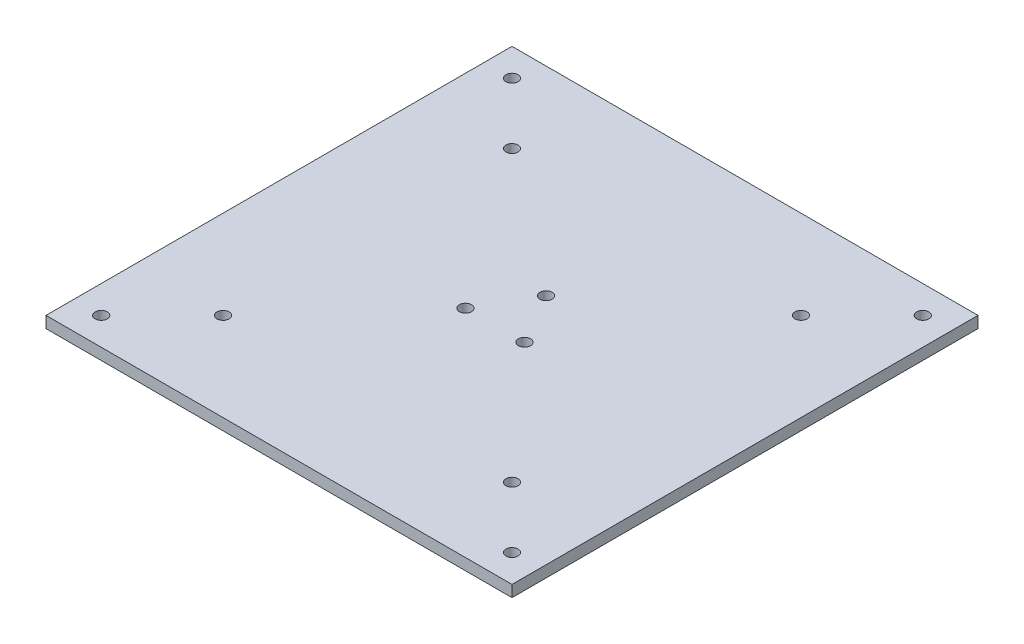
from build123d import *

# Parameters (mm, degrees)
SKETCH2_W           = 130
SKETCH2_H           = 130
BOSS_EXTRUDE1_DEPTH = 3.2
CUT_EXTRUDE1_REACH  = 93.98
SKETCH4_R           = 1.7
CUT_EXTRUDE2_REACH  = 93.98
SKETCH6_R           = 1.7
SKETCH7_R           = 4.25
BOSS_EXTRUDE3_DEPTH = 3.5
FILLET3_R           = 1.5
FILLET4_R           = 0.8
CUT_EXTRUDE3_REACH  = 94.168
SKETCH8_R           = 1.7


with BuildPart() as part:
    # Sketch2 → Boss-Extrude1 (new body)
    with BuildSketch(Plane(origin=(0, 0, 0), x_dir=(1, 0, 0), z_dir=(0, 1, 0))):
        Rectangle(SKETCH2_W, SKETCH2_H)
    extrude(amount=BOSS_EXTRUDE1_DEPTH)

    # Sketch4 → Cut-Extrude1 (cut, up to next)
    with BuildSketch(Plane(origin=(0, 3.2, 0), x_dir=(1, 0, 0), z_dir=(0, 1, 0)), mode=Mode.PRIVATE) as cut_extrude1_sk1:
        with Locations((-57.3, 57.3)):
            Circle(SKETCH4_R)
    cut_extrude1_tool1 = extrude(cut_extrude1_sk1.sketch, amount=-CUT_EXTRUDE1_REACH, mode=Mode.PRIVATE) & part.part
    # Sketch4 → Cut-Extrude1 (cut, up to next)
    with BuildSketch(Plane(origin=(0, 3.2, 0), x_dir=(1, 0, 0), z_dir=(0, 1, 0)), mode=Mode.PRIVATE) as cut_extrude1_sk2:
        with Locations((57.3, 57.3)):
            Circle(SKETCH4_R)
    cut_extrude1_tool2 = extrude(cut_extrude1_sk2.sketch, amount=-CUT_EXTRUDE1_REACH, mode=Mode.PRIVATE) & part.part
    # Sketch4 → Cut-Extrude1 (cut, up to next)
    with BuildSketch(Plane(origin=(0, 3.2, 0), x_dir=(1, 0, 0), z_dir=(0, 1, 0)), mode=Mode.PRIVATE) as cut_extrude1_sk3:
        with Locations((57.3, -57.3)):
            Circle(SKETCH4_R)
    cut_extrude1_tool3 = extrude(cut_extrude1_sk3.sketch, amount=-CUT_EXTRUDE1_REACH, mode=Mode.PRIVATE) & part.part
    # Sketch4 → Cut-Extrude1 (cut, up to next)
    with BuildSketch(Plane(origin=(0, 3.2, 0), x_dir=(1, 0, 0), z_dir=(0, 1, 0)), mode=Mode.PRIVATE) as cut_extrude1_sk4:
        with Locations((-57.3, -57.3)):
            Circle(SKETCH4_R)
    cut_extrude1_tool4 = extrude(cut_extrude1_sk4.sketch, amount=-CUT_EXTRUDE1_REACH, mode=Mode.PRIVATE) & part.part
    add(cut_extrude1_tool1.solids().sort_by_distance((-57.3, 3.2, -57.3))[0], mode=Mode.SUBTRACT)
    add(cut_extrude1_tool2.solids().sort_by_distance((57.3, 3.2, -57.3))[0], mode=Mode.SUBTRACT)
    add(cut_extrude1_tool3.solids().sort_by_distance((57.3, 3.2, 57.3))[0], mode=Mode.SUBTRACT)
    add(cut_extrude1_tool4.solids().sort_by_distance((-57.3, 3.2, 57.3))[0], mode=Mode.SUBTRACT)

    # Sketch6 → Cut-Extrude2 (cut, up to next)
    with BuildSketch(Plane(origin=(0, 3.2, 0), x_dir=(1, 0, 0), z_dir=(0, 1, 0)), mode=Mode.PRIVATE) as cut_extrude2_sk1:
        with Locations((-40.305086528, 40.305086528)):
            Circle(SKETCH6_R)
    cut_extrude2_tool1 = extrude(cut_extrude2_sk1.sketch, amount=-CUT_EXTRUDE2_REACH, mode=Mode.PRIVATE) & part.part
    # Sketch6 → Cut-Extrude2 (cut, up to next)
    with BuildSketch(Plane(origin=(0, 3.2, 0), x_dir=(1, 0, 0), z_dir=(0, 1, 0)), mode=Mode.PRIVATE) as cut_extrude2_sk2:
        with Locations((40.305086528, 40.305086528)):
            Circle(SKETCH6_R)
    cut_extrude2_tool2 = extrude(cut_extrude2_sk2.sketch, amount=-CUT_EXTRUDE2_REACH, mode=Mode.PRIVATE) & part.part
    # Sketch6 → Cut-Extrude2 (cut, up to next)
    with BuildSketch(Plane(origin=(0, 3.2, 0), x_dir=(1, 0, 0), z_dir=(0, 1, 0)), mode=Mode.PRIVATE) as cut_extrude2_sk3:
        with Locations((40.305086528, -40.305086528)):
            Circle(SKETCH6_R)
    cut_extrude2_tool3 = extrude(cut_extrude2_sk3.sketch, amount=-CUT_EXTRUDE2_REACH, mode=Mode.PRIVATE) & part.part
    # Sketch6 → Cut-Extrude2 (cut, up to next)
    with BuildSketch(Plane(origin=(0, 3.2, 0), x_dir=(1, 0, 0), z_dir=(0, 1, 0)), mode=Mode.PRIVATE) as cut_extrude2_sk4:
        with Locations((-40.305086528, -40.305086528)):
            Circle(SKETCH6_R)
    cut_extrude2_tool4 = extrude(cut_extrude2_sk4.sketch, amount=-CUT_EXTRUDE2_REACH, mode=Mode.PRIVATE) & part.part
    add(cut_extrude2_tool1.solids().sort_by_distance((-40.305087, 3.2, -40.305087))[0], mode=Mode.SUBTRACT)
    add(cut_extrude2_tool2.solids().sort_by_distance((40.305087, 3.2, -40.305087))[0], mode=Mode.SUBTRACT)
    add(cut_extrude2_tool3.solids().sort_by_distance((40.305087, 3.2, 40.305087))[0], mode=Mode.SUBTRACT)
    add(cut_extrude2_tool4.solids().sort_by_distance((-40.305087, 3.2, 40.305087))[0], mode=Mode.SUBTRACT)

    # Sketch7 → Boss-Extrude3 (add)
    # profile 1 of 4: a face of its own
    with BuildSketch(Plane.XZ):
        with Locations((-40.305086528, 40.305086528)):
            Circle(SKETCH7_R)
        Polygon((-37.152754058, 40.305086528), (-38.728920293, 43.035086528), (-41.881252763, 43.035086528), (-43.457418997, 40.305086528), (-41.881252763, 37.575086528), (-38.728920293, 37.575086528), align=None, mode=Mode.SUBTRACT)
    # profile 2 of 4: a face of its own
    with BuildSketch(Plane.XZ):
        with Locations((40.305086528, 40.305086528)):
            Circle(SKETCH7_R)
        Polygon((40.305086528, 37.152754058), (43.035086528, 38.728920293), (43.035086528, 41.881252763), (40.305086528, 43.457418997), (37.575086528, 41.881252763), (37.575086528, 38.728920293), align=None, mode=Mode.SUBTRACT)
    # profile 3 of 4: a face of its own
    with BuildSketch(Plane.XZ):
        with Locations((40.305086528, -40.305086528)):
            Circle(SKETCH7_R)
        Polygon((37.152754058, -40.305086528), (38.728920293, -43.035086528), (41.881252763, -43.035086528), (43.457418997, -40.305086528), (41.881252763, -37.575086528), (38.728920293, -37.575086528), align=None, mode=Mode.SUBTRACT)
    # profile 4 of 4: a face of its own
    with BuildSketch(Plane.XZ):
        with Locations((-40.305086528, -40.305086528)):
            Circle(SKETCH7_R)
        Polygon((-40.305086528, -37.152754058), (-43.035086528, -38.728920293), (-43.035086528, -41.881252763), (-40.305086528, -43.457418997), (-37.575086528, -41.881252763), (-37.575086528, -38.728920293), align=None, mode=Mode.SUBTRACT)
    extrude(amount=BOSS_EXTRUDE3_DEPTH)

    # Fillet3
    fillet3_edges = [part.edges().sort_by_distance(p)[0] for p in [
        (36.055086528, 0, -40.305086528),
        (36.055086528, 0, 40.305086528),
        (-44.555086528, 0, 40.305086528),
        (-44.555086528, 0, -40.305086528),
    ]]
    fillet(fillet3_edges, radius=FILLET3_R)

    # Fillet4
    fillet4_edges = [part.edges().sort_by_distance(p)[0] for p in [
        (-43.035086528, -3.5, -40.305086528),
        (-38.940086528, -3.5, -42.66933588),
        (-37.575086528, -3.5, -40.305086528),
        (-38.940086528, -3.5, -37.940837175),
        (-41.670086528, -3.5, -37.940837175),
        (-41.670086528, -3.5, -42.66933588),
        (42.66933588, -3.5, -41.670086528),
        (42.66933588, -3.5, -38.940086528),
        (40.305086528, -3.5, -37.575086528),
        (37.940837175, -3.5, -38.940086528),
        (37.940837175, -3.5, -41.670086528),
        (40.305086528, -3.5, -43.035086528),
        (43.035086528, -3.5, 40.305086528),
        (41.670086528, -3.5, 42.66933588),
        (38.940086528, -3.5, 42.66933588),
        (37.575086528, -3.5, 40.305086528),
        (38.940086528, -3.5, 37.940837175),
        (41.670086528, -3.5, 37.940837175),
        (-40.305086528, -3.5, 43.035086528),
        (-42.66933588, -3.5, 41.670086528),
        (-42.66933588, -3.5, 38.940086528),
        (-37.940837175, -3.5, 38.940086528),
        (-37.940837175, -3.5, 41.670086528),
        (-40.305086528, -3.5, 37.575086528),
    ]]
    fillet(fillet4_edges, radius=FILLET4_R)

    # Sketch8 → Cut-Extrude3 (cut, up to next)
    with BuildSketch(Plane(origin=(0, 3.2, 0), x_dir=(1, 0, 0), z_dir=(0, 1, 0)), mode=Mode.PRIVATE) as cut_extrude3_sk1:
        with Locations((0, 9.5)):
            Circle(SKETCH8_R)
    cut_extrude3_tool1 = extrude(cut_extrude3_sk1.sketch, amount=-CUT_EXTRUDE3_REACH, mode=Mode.PRIVATE) & part.part
    # Sketch8 → Cut-Extrude3 (cut, up to next)
    with BuildSketch(Plane(origin=(0, 3.2, 0), x_dir=(1, 0, 0), z_dir=(0, 1, 0)), mode=Mode.PRIVATE) as cut_extrude3_sk2:
        with Locations((8.227241336, -4.75)):
            Circle(SKETCH8_R)
    cut_extrude3_tool2 = extrude(cut_extrude3_sk2.sketch, amount=-CUT_EXTRUDE3_REACH, mode=Mode.PRIVATE) & part.part
    # Sketch8 → Cut-Extrude3 (cut, up to next)
    with BuildSketch(Plane(origin=(0, 3.2, 0), x_dir=(1, 0, 0), z_dir=(0, 1, 0)), mode=Mode.PRIVATE) as cut_extrude3_sk3:
        with Locations((-8.227241336, -4.75)):
            Circle(SKETCH8_R)
    cut_extrude3_tool3 = extrude(cut_extrude3_sk3.sketch, amount=-CUT_EXTRUDE3_REACH, mode=Mode.PRIVATE) & part.part
    add(cut_extrude3_tool1.solids().sort_by_distance((0, 3.2, -9.5))[0], mode=Mode.SUBTRACT)
    add(cut_extrude3_tool2.solids().sort_by_distance((8.227241, 3.2, 4.75))[0], mode=Mode.SUBTRACT)
    add(cut_extrude3_tool3.solids().sort_by_distance((-8.227241, 3.2, 4.75))[0], mode=Mode.SUBTRACT)


solid = part.part
